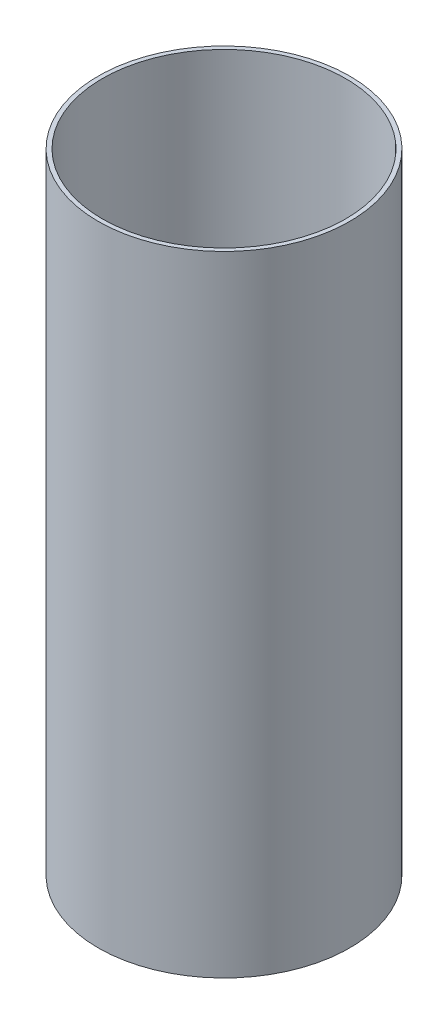
from build123d import *

# Parameters (mm, degrees)
SKETCH1_R           = 60
SKETCH1_R_2         = 58
BOSS_EXTRUDE1_DEPTH = 300


with BuildPart() as part:
    # Sketch1 → Boss-Extrude1 (new body)
    with BuildSketch(Plane(origin=(0, 0, 0), x_dir=(1, 0, 0), z_dir=(0, 1, 0))):
        Circle(SKETCH1_R)
        Circle(SKETCH1_R_2, mode=Mode.SUBTRACT)
    extrude(amount=BOSS_EXTRUDE1_DEPTH)


solid = part.part
